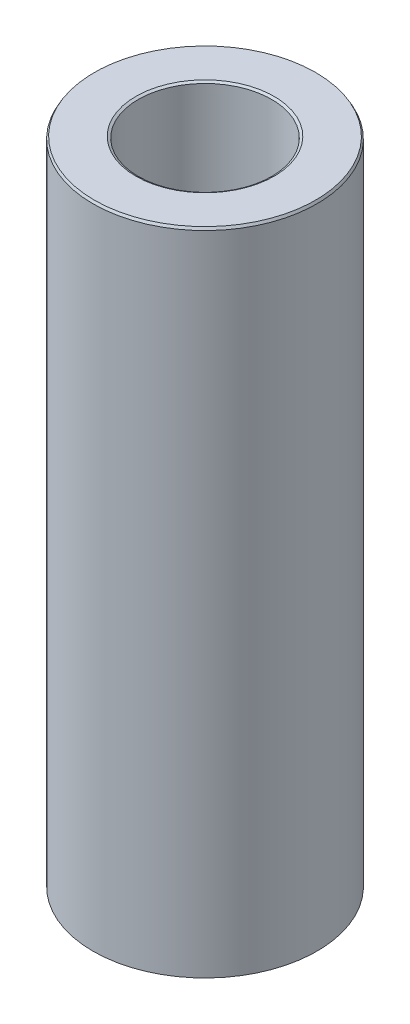
from build123d import *
from OCP.BRepFilletAPI import BRepFilletAPI_MakeChamfer

# Parameters (mm, degrees)
SKETCH1_R           = 57.5
BOSS_EXTRUDE1_DEPTH = 334.200777145
SKETCH2_R           = 34.248790369
CUT_EXTRUDE1_DEPTH  = 344.951536476
CHAMFER1_SIZE       = 1.250886469
CHAMFER1_SIZE2      = 0.72219964


with BuildPart() as part:
    # Sketch1 → Boss-Extrude1 (new body)
    with BuildSketch(Plane(origin=(0, 0, 0), x_dir=(1, 0, 0), z_dir=(0, 1, 0))):
        Circle(SKETCH1_R)
    extrude(amount=BOSS_EXTRUDE1_DEPTH)

    # Sketch2 → Cut-Extrude1 (cut, through all)
    with BuildSketch(Plane(origin=(0, 0, 0), x_dir=(1, 0, 0), z_dir=(0, 1, 0))):
        Circle(SKETCH2_R)
    extrude(amount=CUT_EXTRUDE1_DEPTH, mode=Mode.SUBTRACT)

    # Chamfer1: one chamfer whose edges measure the first distance from different faces: ONE call of the kernel's chamfer builder (chamfer() names one face for all edges)
    chamfer1_edges_1 = [part.edges().sort_by_distance(p)[0] for p in [
        (-34.248790369, 334.200777145, 0),
    ]]
    chamfer1_side_1 = [part.faces().sort_by_distance(p)[0] for p in [
        (-55.873654403, 334.200777145, 0),
    ]]
    chamfer1_edges_2 = [part.edges().sort_by_distance(p)[0] for p in [
        (-34.248790369, 0, 0),
    ]]
    chamfer1_side_2 = [part.faces().sort_by_distance(p)[0] for p in [
        (-34.248790369, 167.100388572, 0),
    ]]
    chamfer1_edges_3 = [part.edges().sort_by_distance(p)[0] for p in [
        (-57.5, 0, 0),
    ]]
    chamfer1_side_3 = [part.faces().sort_by_distance(p)[0] for p in [
        (-55.873654403, 0, 0),
    ]]
    chamfer1_edges_4 = [part.edges().sort_by_distance(p)[0] for p in [
        (-57.5, 334.200777145, 0),
    ]]
    chamfer1_side_4 = [part.faces().sort_by_distance(p)[0] for p in [
        (-57.5, 167.100388572, 0),
    ]]
    chamfer1 = BRepFilletAPI_MakeChamfer(part.part.solid().wrapped)
    for e in chamfer1_edges_1:
        chamfer1.Add(CHAMFER1_SIZE, CHAMFER1_SIZE2, e.wrapped, chamfer1_side_1[0].wrapped)  # the first distance lies on this face
    for e in chamfer1_edges_2:
        chamfer1.Add(CHAMFER1_SIZE, CHAMFER1_SIZE2, e.wrapped, chamfer1_side_2[0].wrapped)  # the first distance lies on this face
    for e in chamfer1_edges_3:
        chamfer1.Add(CHAMFER1_SIZE, CHAMFER1_SIZE2, e.wrapped, chamfer1_side_3[0].wrapped)  # the first distance lies on this face
    for e in chamfer1_edges_4:
        chamfer1.Add(CHAMFER1_SIZE, CHAMFER1_SIZE2, e.wrapped, chamfer1_side_4[0].wrapped)  # the first distance lies on this face
    add(Compound.cast(chamfer1.Shape()), mode=Mode.REPLACE)


solid = part.part
